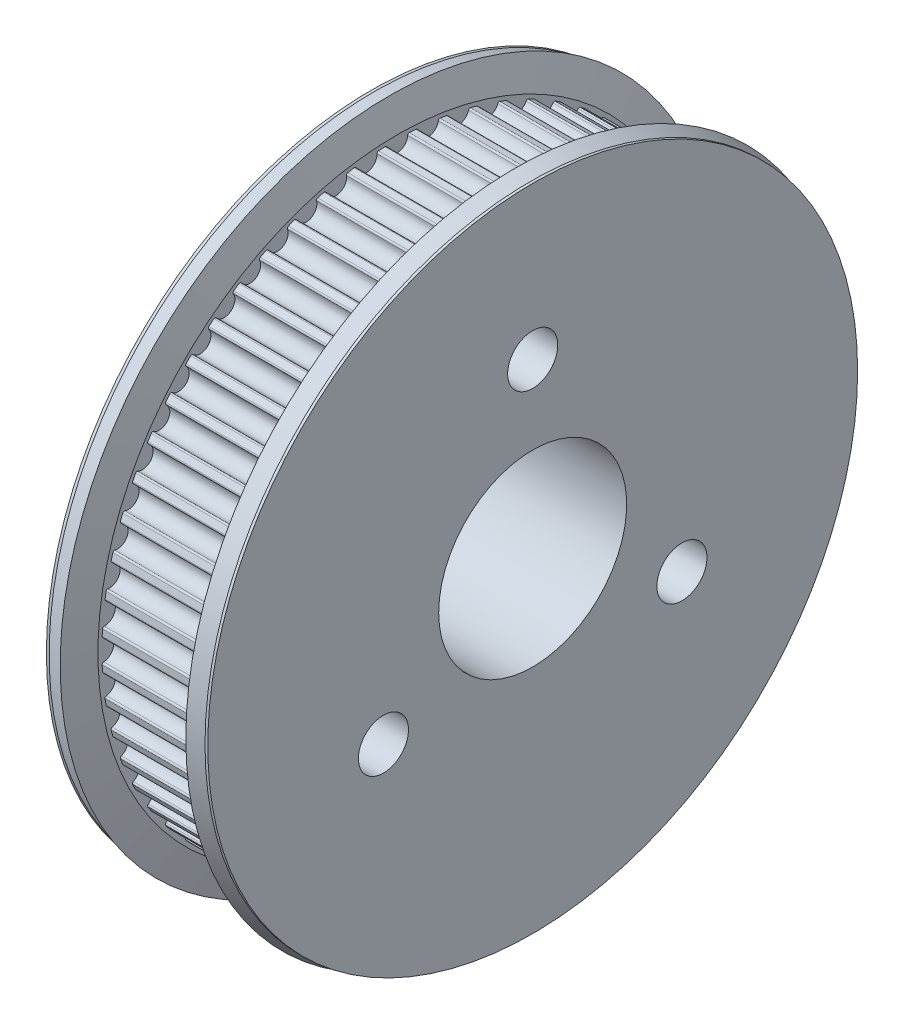
from build123d import *

# Parameters (mm, degrees)
SKETCH_1_W                    = 7
SKETCH_1_H                    = 18.845
SKETCH_2_R                    = 16.5
EXTRUDE_1_DEPTH               = 1.65
EXTRUDE_START                 = 1.65
SKETCH_3_R                    = 16.5
EXTRUDE_2_DEPTH               = 1.65
HOLE_WIZARD_1_35_1_35_1_D     = 1.35
HOLE_WIZARD_1_35_1_35_1_DEPTH = 8.65
HOLE_WIZARD_12_0_12_1_D       = 12
FILLET_1_R                    = 0.1
SKETCH_10_R                   = 1.6
CUT_EXTRUDE_1_DEPTH           = 32.433898899


# Read off the part's stored shape, not the designer's step: ﾎﾞｽ - 押し出し3, ﾎﾞｽ - 押し出し4
with BuildPart() as part:
    # ｽｹｯﾁ1 → 回転1 (revolve)
    with BuildSketch(Plane(origin=(0, 0, 0), x_dir=(-1, 0, 0), z_dir=(0, 0, -1)), mode=Mode.PRIVATE) as revolve_1_sk:
        with Locations((-5.15, 9.4225)):
            Rectangle(SKETCH_1_W, SKETCH_1_H)
    revolve(revolve_1_sk.sketch.rotate(Axis((8.65, 0, 0), (-1, 0, 0)), 270), axis=Axis((8.65, 0, 0), (-1, 0, 0)))

    # ｽｹｯﾁ2 → ﾎﾞｽ - 押し出し1 (add)
    with BuildSketch(Plane.ZY.offset(-1.65)):
        Circle(SKETCH_2_R)
    extrude(amount=EXTRUDE_1_DEPTH)

    # ｽｹｯﾁ3 → ﾎﾞｽ - 押し出し2 (add)
    with BuildSketch(Plane(origin=(8.65, 0, 0), x_dir=(0, 0, -1), z_dir=(1, 0, 0)).offset(EXTRUDE_START)):
        with Locations(Location((0, 0, 0), (0, 0, 180))):
            Circle(SKETCH_3_R)
    extrude(amount=-EXTRUDE_2_DEPTH)

    # Ø1.35 (1.35) 直径の穴1
    with Locations(Plane.ZY.offset(-1.65)):
        with Locations((0, 18.77), (-1.961999256, 18.667175976), (-3.902502437, 18.359830466), (-5.800248984, 17.851330811), (-7.634446791, 17.14724824), (-9.385, 16.255296829), (-11.032729186, 15.185248984), (-12.559581481, 13.948828374), (-13.948828374, 12.559581481), (-15.185248984, 11.032729186), (-16.255296829, 9.385), (-17.14724824, 7.634446791), (-17.851330811, 5.800248984), (-18.359830466, 3.902502437), (-18.667175976, 1.961999256), (-18.77, 0), (-18.667175976, -1.961999256), (-18.359830466, -3.902502437), (-17.851330811, -5.800248984), (-17.14724824, -7.634446791), (-16.255296829, -9.385), (-15.185248984, -11.032729186), (-13.948828374, -12.559581481), (-12.559581481, -13.948828374), (-11.032729186, -15.185248984), (-9.385, -16.255296829), (-7.634446791, -17.14724824), (-5.800248984, -17.851330811), (-3.902502437, -18.359830466), (-1.961999256, -18.667175976), (0, -18.77), (1.961999256, -18.667175976), (3.902502437, -18.359830466), (5.800248984, -17.851330811), (7.634446791, -17.14724824), (9.385, -16.255296829), (11.032729186, -15.185248984), (12.559581481, -13.948828374), (13.948828374, -12.559581481), (15.185248984, -11.032729186), (16.255296829, -9.385), (17.14724824, -7.634446791), (17.851330811, -5.800248984), (18.359830466, -3.902502437), (18.667175976, -1.961999256), (18.77, 0), (18.667175976, 1.961999256), (18.359830466, 3.902502437), (17.851330811, 5.800248984), (17.14724824, 7.634446791), (16.255296829, 9.385), (15.185248984, 11.032729186), (13.948828374, 12.559581481), (12.559581481, 13.948828374), (11.032729186, 15.185248984), (9.385, 16.255296829), (7.634446791, 17.14724824), (5.800248984, 17.851330811), (3.902502437, 18.359830466), (1.961999256, 18.667175976)):
            Hole(HOLE_WIZARD_1_35_1_35_1_D / 2, depth=HOLE_WIZARD_1_35_1_35_1_DEPTH)

    # Ø12.0 (12) 直径の穴1 (through all)
    with Locations(Plane.ZY):
        with Locations((0, 0)):
            Hole(HOLE_WIZARD_12_0_12_1_D / 2)

    # ﾌｨﾚｯﾄ1
    fillet_1_edges = [part.edges().sort_by_distance(p)[0] for p in [
        (5.15, -18.800092173, -1.300215088),
        (5.15, -18.65959497, -2.636956683),
        (5.15, -18.561193816, -3.258237118),
        (5.15, -18.281738727, -4.572969946),
        (5.15, -18.118935136, -5.18056122),
        (5.15, -17.703583928, -6.458880792),
        (5.15, -17.47816161, -7.04612601),
        (5.15, -16.931464959, -8.274026791),
        (5.15, -16.645893688, -8.834491968),
        (5.15, -15.973841318, -9.998520819),
        (5.15, -15.631249871, -10.526065384),
        (5.15, -14.841204927, -11.613468961),
        (5.15, -14.445346811, -12.102313024),
        (5.15, -13.54596519, -13.101177507),
        (5.15, -13.101177507, -13.54596519),
        (5.15, -12.102313024, -14.445346811),
        (5.15, -11.613468961, -14.841204927),
        (5.15, -10.526065384, -15.631249871),
        (5.15, 18.118935136, 5.18056122),
        (5.15, 17.703583928, 6.458880792),
        (5.15, -9.998520819, -15.973841318),
        (5.15, -8.834491968, -16.645893688),
        (5.15, -8.274026791, -16.931464959),
        (5.15, -7.04612601, -17.47816161),
        (5.15, -6.458880792, -17.703583928),
        (5.15, -5.18056122, -18.118935136),
        (5.15, -4.572969946, -18.281738727),
        (5.15, -3.258237118, -18.561193816),
        (5.15, -2.636956683, -18.65959497),
        (5.15, -1.300215088, -18.800092173),
        (5.15, -0.672052371, -18.833012786),
        (5.15, 0.672052371, -18.833012786),
        (5.15, 1.300215088, -18.800092173),
        (5.15, 2.636956683, -18.65959497),
        (5.15, 3.258237118, -18.561193816),
        (5.15, 4.572969946, -18.281738727),
        (5.15, 5.18056122, -18.118935136),
        (5.15, 6.458880792, -17.703583928),
        (5.15, 7.04612601, -17.47816161),
        (5.15, 8.274026791, -16.931464959),
        (5.15, 17.47816161, 7.04612601),
        (5.15, 16.931464959, 8.274026791),
        (5.15, 8.834491968, -16.645893688),
        (5.15, 9.998520819, -15.973841318),
        (5.15, 10.526065384, -15.631249871),
        (5.15, 11.613468961, -14.841204927),
        (5.15, 12.102313024, -14.445346811),
        (5.15, 13.101177507, -13.54596519),
        (5.15, 13.54596519, -13.101177507),
        (5.15, 14.445346811, -12.102313024),
        (5.15, 14.841204927, -11.613468961),
        (5.15, 15.631249871, -10.526065384),
        (5.15, 15.973841318, -9.998520819),
        (5.15, 16.645893688, -8.834491968),
        (5.15, 16.931464959, -8.274026791),
        (5.15, 17.47816161, -7.04612601),
        (5.15, 17.703583928, -6.458880792),
        (5.15, 18.118935136, -5.18056122),
        (5.15, 18.281738727, -4.572969946),
        (5.15, 18.561193816, -3.258237118),
        (5.15, 18.65959497, -2.636956683),
        (5.15, 18.800092173, -1.300215088),
        (5.15, 16.645893688, 8.834491968),
        (5.15, 15.973841318, 9.998520819),
        (5.15, 18.833012786, -0.672052371),
        (5.15, 18.833012786, 0.672052371),
        (5.15, 15.631249871, 10.526065384),
        (5.15, 14.841204927, 11.613468961),
        (5.15, 14.445346811, 12.102313024),
        (5.15, 13.54596519, 13.101177507),
        (5.15, 13.101177507, 13.54596519),
        (5.15, 12.102313024, 14.445346811),
        (5.15, 11.613468961, 14.841204927),
        (5.15, 10.526065384, 15.631249871),
        (5.15, 9.998520819, 15.973841318),
        (5.15, 8.834491968, 16.645893688),
        (5.15, 8.274026791, 16.931464959),
        (5.15, 7.04612601, 17.47816161),
        (5.15, 6.458880792, 17.703583928),
        (5.15, 5.18056122, 18.118935136),
        (5.15, 4.572969946, 18.281738727),
        (5.15, 3.258237118, 18.561193816),
        (5.15, 2.636956683, 18.65959497),
        (5.15, 1.300215088, 18.800092173),
        (5.15, 0.672052371, 18.833012786),
        (5.15, -0.672052371, 18.833012786),
        (5.15, -1.300215088, 18.800092173),
        (5.15, -2.636956683, 18.65959497),
        (5.15, -3.258237118, 18.561193816),
        (5.15, -4.572969946, 18.281738727),
        (5.15, -5.18056122, 18.118935136),
        (5.15, -6.458880792, 17.703583928),
        (5.15, -7.04612601, 17.47816161),
        (5.15, -8.274026791, 16.931464959),
        (5.15, 18.800092173, 1.300215088),
        (5.15, 18.65959497, 2.636956683),
        (5.15, -8.834491968, 16.645893688),
        (5.15, -9.998520819, 15.973841318),
        (5.15, -10.526065384, 15.631249871),
        (5.15, -11.613468961, 14.841204927),
        (5.15, -12.102313024, 14.445346811),
        (5.15, -13.101177507, 13.54596519),
        (5.15, -13.54596519, 13.101177507),
        (5.15, -14.445346811, 12.102313024),
        (5.15, -14.841204927, 11.613468961),
        (5.15, -15.631249871, 10.526065384),
        (5.15, -15.973841318, 9.998520819),
        (5.15, -16.645893688, 8.834491968),
        (5.15, -16.931464959, 8.274026791),
        (5.15, -17.47816161, 7.04612601),
        (5.15, -17.703583928, 6.458880792),
        (5.15, -18.118935136, 5.18056122),
        (5.15, -18.281738727, 4.572969946),
        (5.15, -18.561193816, 3.258237118),
        (5.15, -18.65959497, 2.636956683),
        (5.15, -18.800092173, 1.300215088),
        (5.15, 18.561193816, 3.258237118),
        (5.15, 18.281738727, 4.572969946),
        (5.15, -18.833012786, 0.672052371),
        (5.15, -18.833012786, -0.672052371),
    ]]
    fillet(fillet_1_edges, radius=FILLET_1_R)

    # ﾎﾞｽ - 押し出し3 outline → ﾎﾞｽ - 押し出し3 (revolve)
    with BuildSketch(Plane.YX):
        Polygon((16.5, 1.65), (16.5, 0), (20.741180955, 0), (20.741180955, 0.174970708), (21, 1.140896534), (19.1, 1.65), align=None)
    revolve(axis=Axis((0, 0, 0), (1, 0, 0)))

    # ﾎﾞｽ - 押し出し4 outline → ﾎﾞｽ - 押し出し4 (revolve)
    with BuildSketch(Plane.YX):
        Polygon((16.5, 10.3), (16.5, 8.65), (19.1, 8.65), (21, 9.159103466), (20.741180955, 10.125029292), (20.741180955, 10.3), align=None)
    revolve(axis=Axis((0, 0, 0), (1, 0, 0)))

    # ｽｹｯﾁ10 → ｶｯﾄ - 押し出し1 (cut, through all)
    with BuildSketch(Plane.ZY):
        with Locations((0, 11)):
            Circle(SKETCH_10_R)
        with Locations((9.526279442, -5.5)):
            Circle(SKETCH_10_R)
        with Locations((-9.526279442, -5.5)):
            Circle(SKETCH_10_R)
    extrude(amount=-CUT_EXTRUDE_1_DEPTH, mode=Mode.SUBTRACT)


solid = part.part
